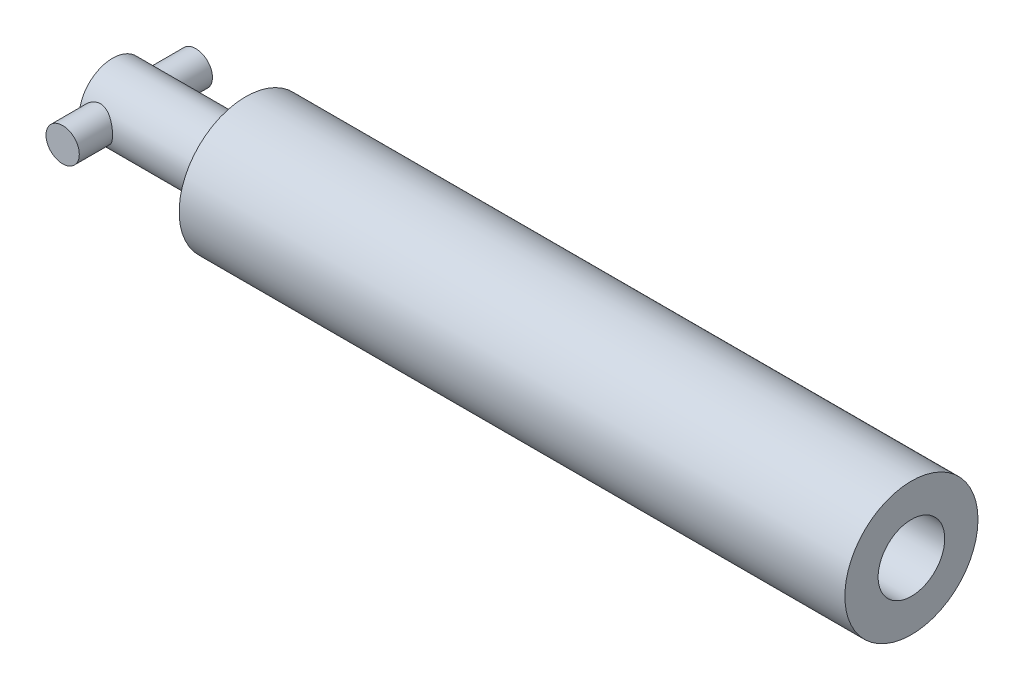
from build123d import *

# Parameters (mm, degrees)
SKETCH1_R           = 25.4
BOSS_EXTRUDE1_DEPTH = 127
SKETCH2_R           = 12.7
BOSS_EXTRUDE2_DEPTH = 50.8
SKETCH3_R           = 6.35
BOSS_EXTRUDE3_DEPTH = 25.4
SKETCH4_R           = 12.7
CUT_EXTRUDE1_DEPTH  = 228.6


with BuildPart() as part:
    # Sketch1 → Boss-Extrude1 (new, symmetric)
    with BuildSketch(Plane(origin=(0, 0, 0), x_dir=(0, 0, -1), z_dir=(1, 0, 0))):
        Circle(SKETCH1_R)
    extrude(amount=BOSS_EXTRUDE1_DEPTH, both=True)

    # Sketch2 → Boss-Extrude2 (add)
    with BuildSketch(Plane.ZY.offset(127)):
        Circle(SKETCH2_R)
    extrude(amount=BOSS_EXTRUDE2_DEPTH)

    # Sketch3 → Boss-Extrude3 (add, symmetric)
    with BuildSketch(Plane.XY):
        with Locations((-171.45, 0)):
            Circle(SKETCH3_R)
    extrude(amount=BOSS_EXTRUDE3_DEPTH, both=True)

    # Sketch4 → Cut-Extrude1 (cut)
    with BuildSketch(Plane(origin=(127, 0, 0), x_dir=(0, 0, -1), z_dir=(1, 0, 0))):
        Circle(SKETCH4_R)
    extrude(amount=-CUT_EXTRUDE1_DEPTH, mode=Mode.SUBTRACT)


solid = part.part
